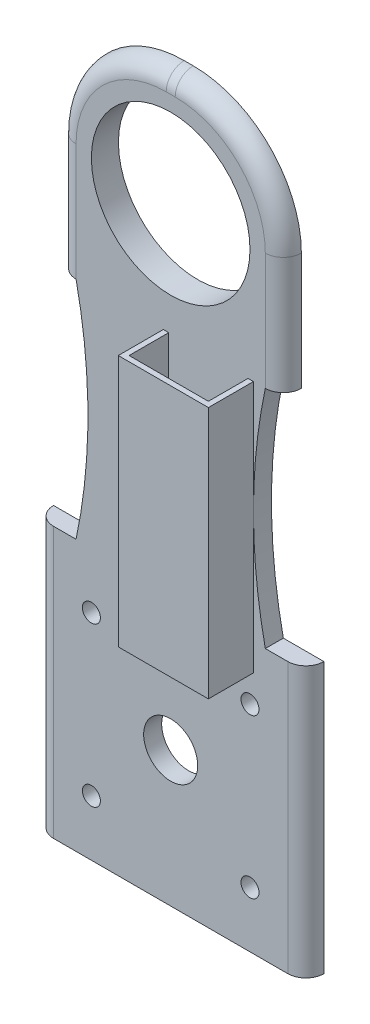
from build123d import *

# Parameters (mm, degrees)
SKETCH1_R           = 11.176
SKETCH1_R_2         = 1.27
SKETCH1_R_3         = 3.81
BOSS_EXTRUDE1_DEPTH = 2.54
FILLET2_R           = 2.54
FILLET3_R           = 2.54
BOSS_EXTRUDE2_START = 1.27
SKETCH2_R           = 13.716
SKETCH2_R_2         = 11.176
BOSS_EXTRUDE2_DEPTH = 1.27
SKETCH3_W           = 7.366
SKETCH3_H           = 7.366
CUT_EXTRUDE1_DEPTH  = 2.54
SKETCH4_W           = 12.7
SKETCH4_H           = 35.56
SKETCH4_W_2         = 11.176
SKETCH4_H_2         = 34.036
EXTRUDE_THIN1_DEPTH = 6.35
SKETCH5_W           = 11.176
SKETCH5_H           = 6.35
CUT_EXTRUDE2_DEPTH  = 38.1
SKETCH6_W           = 12.7
SKETCH6_H           = 35.56
BOSS_EXTRUDE3_DEPTH = 0.762


with BuildPart() as part:
    # Sketch1 → Boss-Extrude1 (new body)
    with BuildSketch(Plane.XY):
        with BuildLine():
            Line((-13.335, -47.625), (-19.05, -47.625))
            Line((-19.05, -47.625), (-19.05, -85.725))
            Line((-19.05, -85.725), (19.05, -85.725))
            Line((19.05, -85.725), (19.05, -47.625))
            Line((19.05, -47.625), (13.335, -47.625))
            ThreePointArc((13.335, -47.625), (11.663010674, -31.75), (13.335, -15.875))
            Line((13.335, -15.875), (15.875, -15.875))
            Line((15.875, -15.875), (15.875, 0.635))
            ThreePointArc((15.875, 0.635), (11.411307345, 11.411307345), (0.635, 15.875))
            Line((0.635, 15.875), (-0.635, 15.875))
            ThreePointArc((-0.635, 15.875), (-11.411307345, 11.411307345), (-15.875, 0.635))
            Line((-15.875, 0.635), (-15.875, -15.875))
            Line((-15.875, -15.875), (-13.335, -15.875))
            ThreePointArc((-13.335, -15.875), (-11.663010674, -31.75), (-13.335, -47.625))
        make_face()
        Circle(SKETCH1_R, mode=Mode.SUBTRACT)
        with Locations((11.176, -55.499)):
            Circle(SKETCH1_R_2, mode=Mode.SUBTRACT)
        with Locations((11.176, -77.851)):
            Circle(SKETCH1_R_2, mode=Mode.SUBTRACT)
        with Locations((-11.176, -77.851)):
            Circle(SKETCH1_R_2, mode=Mode.SUBTRACT)
        with Locations((-11.176, -55.499)):
            Circle(SKETCH1_R_2, mode=Mode.SUBTRACT)
        with Locations((0, -66.675)):
            Circle(SKETCH1_R_3, mode=Mode.SUBTRACT)
    extrude(amount=BOSS_EXTRUDE1_DEPTH)

    # Fillet2
    fillet2_edges = [part.edges().sort_by_distance(p)[0] for p in [
        (19.05, -66.675, 2.54),
        (-19.05, -66.675, 2.54),
    ]]
    fillet(fillet2_edges, radius=FILLET2_R - 0.0001)  # a hair under: the kernel refuses the full size

    # Fillet3
    fillet3_edges = [part.edges().sort_by_distance(p)[0] for p in [
        (15.875, -7.62, 2.54),
        (11.411307345, 11.411307345, 2.54),
        (0, 15.875, 2.54),
        (-11.411307345, 11.411307345, 2.54),
        (-15.875, -7.62, 2.54),
    ]]
    fillet(fillet3_edges, radius=FILLET3_R - 0.0001)  # a hair under: the kernel refuses the full size

    # Sketch2 → Boss-Extrude2 (add)
    with BuildSketch(Plane(origin=(0, 0, 0), x_dir=(-1, 0, 0), z_dir=(0, 0, -1)).offset(BOSS_EXTRUDE2_START)):
        Circle(SKETCH2_R)
        Circle(SKETCH2_R_2, mode=Mode.SUBTRACT)
    extrude(amount=-BOSS_EXTRUDE2_DEPTH)

    # Sketch3 → Cut-Extrude1 (cut)
    with BuildSketch(Plane.XY.offset(2.54)):
        with Locations((7.218010674, -25.908)):
            Rectangle(SKETCH3_W, SKETCH3_H)
    extrude(amount=-CUT_EXTRUDE1_DEPTH, mode=Mode.SUBTRACT)

    # Sketch4 → Extrude-Thin1 (add)
    with BuildSketch(Plane.XY.offset(2.54)):
        with Locations((5.313010674, -33.655)):
            Rectangle(SKETCH4_W, SKETCH4_H)
        with Locations((5.313010674, -33.655)):
            Rectangle(SKETCH4_W_2, SKETCH4_H_2, mode=Mode.SUBTRACT)
    extrude(amount=EXTRUDE_THIN1_DEPTH)

    # Sketch5 → Cut-Extrude2 (cut)
    with BuildSketch(Plane.XZ.offset(51.435)):
        with Locations((5.313010674, 5.715)):
            Rectangle(SKETCH5_W, SKETCH5_H)
    extrude(amount=-CUT_EXTRUDE2_DEPTH, mode=Mode.SUBTRACT)

    # Sketch6 → Boss-Extrude3 (add)
    with BuildSketch(Plane.XY.offset(8.89)):
        with Locations((5.313010674, -33.655)):
            Rectangle(SKETCH6_W, SKETCH6_H)
    extrude(amount=-BOSS_EXTRUDE3_DEPTH)


solid = part.part
